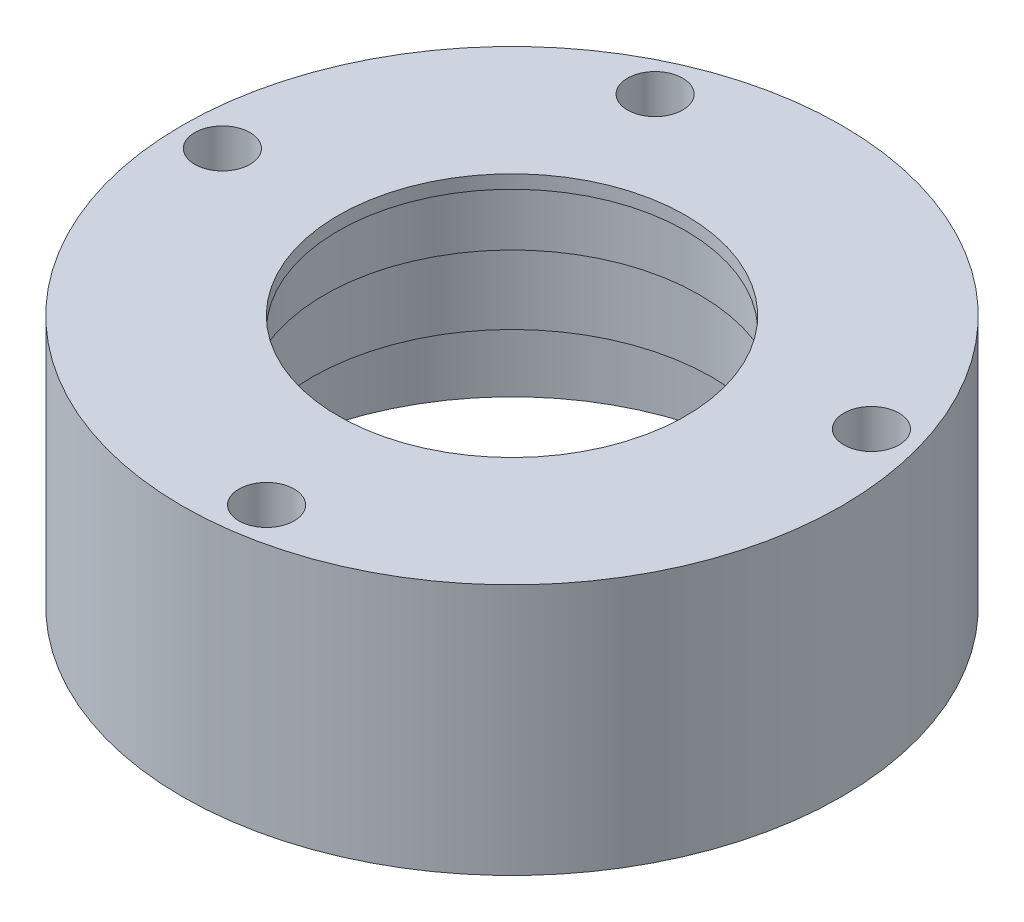
from build123d import *

# Parameters (mm, degrees)
SKETCH1_R           = 37
BOSS_EXTRUDE1_DEPTH = 28.25
SKETCH2_R           = 28.8
CUT_EXTRUDE1_DEPTH  = 11
SKETCH3_R           = 22.5
CUT_EXTRUDE2_DEPTH  = 8.75
SKETCH4_R           = 21.05
CUT_EXTRUDE3_DEPTH  = 7
SKETCH5_R           = 19.5
CUT_EXTRUDE4_DEPTH  = 59.767018812
SKETCH6_R           = 1.65
CUT_EXTRUDE5_DEPTH  = 15.75
CIRPATTERN1_COUNT   = 11
SKETCH7_R           = 1.7
CUT_EXTRUDE6_DEPTH  = 60.464800513
SKETCH8_R           = 3.1
CUT_EXTRUDE7_DEPTH  = 16.25


with BuildPart() as part:
    # Sketch1 → Boss-Extrude1 (new body)
    with BuildSketch(Plane(origin=(0, 0, 0), x_dir=(1, 0, 0), z_dir=(0, 1, 0))):
        Circle(SKETCH1_R)
    extrude(amount=BOSS_EXTRUDE1_DEPTH)

    # Sketch2 → Cut-Extrude1 (cut)
    with BuildSketch(Plane(origin=(0, 0, 0), x_dir=(1, 0, 0), z_dir=(0, 1, 0))):
        Circle(SKETCH2_R)
    extrude(amount=CUT_EXTRUDE1_DEPTH, mode=Mode.SUBTRACT)

    # Sketch3 → Cut-Extrude2 (cut)
    with BuildSketch(Plane.XZ.offset(-11)):
        Circle(SKETCH3_R)
    extrude(amount=-CUT_EXTRUDE2_DEPTH, mode=Mode.SUBTRACT)

    # Sketch4 → Cut-Extrude3 (cut)
    with BuildSketch(Plane.XZ.offset(-19.75)):
        Circle(SKETCH4_R)
    extrude(amount=-CUT_EXTRUDE3_DEPTH, mode=Mode.SUBTRACT)

    # Sketch5 → Cut-Extrude4 (cut, through all)
    with BuildSketch(Plane.XZ.offset(-26.75)):
        Circle(SKETCH5_R)
    extrude(amount=-CUT_EXTRUDE4_DEPTH, mode=Mode.SUBTRACT)

    # Sketch6 → Cut-Extrude5 (cut)
    with BuildSketch(Plane(origin=(0, 0, 0), x_dir=(1, 0, 0), z_dir=(0, 1, 0))):
        with Locations((27, 0)):
            Circle(SKETCH6_R)
    cut_extrude5 = extrude(amount=CUT_EXTRUDE5_DEPTH, mode=Mode.SUBTRACT)

    # CirPattern1: Cut-Extrude5 ×11 about axis
    cirpattern1_axis = Axis((0, 28.25, 0), (0, -1, 0))
    for i in range(1, CIRPATTERN1_COUNT):
        add(cut_extrude5.rotate(cirpattern1_axis, i * 360 / CIRPATTERN1_COUNT), mode=Mode.SUBTRACT)

    # Sketch7 → Cut-Extrude6 (cut, through all)
    with BuildSketch(Plane(origin=(0, 0, 0), x_dir=(1, 0, 0), z_dir=(0, 1, 0))):
        with Locations((31.184102699, 9.154328969)):
            Circle(SKETCH7_R)
        with Locations((-13.503333209, 29.56196868)):
            Circle(SKETCH7_R)
        with Locations((-32.5, 0)):
            Circle(SKETCH7_R)
        with Locations((4.624211408, -32.169343619)):
            Circle(SKETCH7_R)
    extrude(amount=CUT_EXTRUDE6_DEPTH, mode=Mode.SUBTRACT)

    # Sketch8 → Cut-Extrude7 (cut)
    with BuildSketch(Plane(origin=(0, 28.25, 0), x_dir=(1, 0, 0), z_dir=(0, 1, 0))):
        with Locations((31.184102699, 9.154328969)):
            Circle(SKETCH8_R)
        with Locations((-13.503333209, 29.56196868)):
            Circle(SKETCH8_R)
        with Locations((-32.5, 0)):
            Circle(SKETCH8_R)
        with Locations((4.624211408, -32.169343619)):
            Circle(SKETCH8_R)
    extrude(amount=-CUT_EXTRUDE7_DEPTH, mode=Mode.SUBTRACT)


solid = part.part
